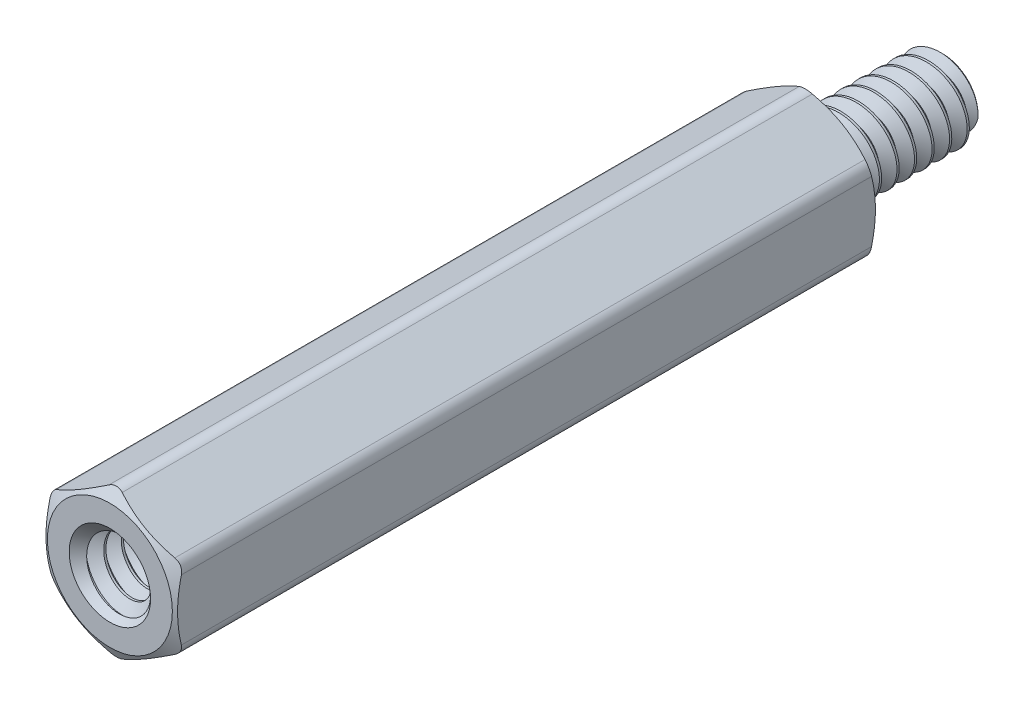
from build123d import *

# Parameters (mm, degrees)
SKETCH4_R           = 1.901825
BOSS_EXTRUDE1_DEPTH = 25.4
SKETCH5_OUTSIDE_W   = 121.674
SKETCH5_OUTSIDE_H   = 122.412
SKETCH5_OUTSIDE_R   = 2.2621875
CUT_EXTRUDE1_DEPTH  = 31.381033994
CUT_EXTRUDE1_DRAFT  = -60
SKETCH6_OUTSIDE_W   = 105.318
SKETCH6_OUTSIDE_H   = 106.056
SKETCH6_OUTSIDE_R   = 2.2621875
CUT_EXTRUDE2_DEPTH  = 26.659127427
CUT_EXTRUDE2_DRAFT  = -60
FILLET1_R           = 0.47625
CUT_SWEEP1_PITCH    = 0.635
SKETCH9_R           = 1.58115
BOSS_EXTRUDE2_DEPTH = 6.35
SKETCH10_W          = 6.35
SKETCH10_H          = 1.4224
CUT_SWEEP2_PITCH    = 0.635


with BuildPart() as part:
    # Sketch3 → Revolve1 (revolve)
    with BuildSketch(Plane(origin=(0, 0, 0), x_dir=(0, 0, -1), z_dir=(1, 0, 0))):
        with BuildLine():
            Line((-19.05, 1.26365), (-19.05, 0))
            Line((-19.05, 0), (4.7625, 0))
            Line((4.7625, 0), (4.7625, 1.26365))
            Line((4.7625, 1.26365), (4.60375, 1.4224))
            Line((4.60375, 1.4224), (0.809625, 1.4224))
            Line((0.809625, 1.4224), (0.5715, 1.009955401))
            Line((0.5715, 1.009955401), (0.15875, 1.009955401))
            ThreePointArc((0.15875, 1.009955401), (0.046496798, 1.0564522), (0, 1.168705401))
            Line((0, 1.168705401), (0, 2.38125))
            Line((0, 2.38125), (-25.4, 2.38125))
            Line((-25.4, 2.38125), (-25.4, 1.58115))
            Line((-25.4, 1.58115), (-25.24125, 1.4224))
            Line((-25.24125, 1.4224), (-19.20875, 1.4224))
            Line((-19.20875, 1.4224), (-19.05, 1.26365))
        make_face()
    revolve(axis=Axis((0, 0, -4.7625), (0, 0, 1)))

    # Sketch4 → Boss-Extrude1 (add)
    with BuildSketch(Plane.XY.offset(25.4)):
        Polygon((-2.38125, 1.374815329), (-2.38125, -1.374815329), (0, -2.749630657), (2.38125, -1.374815329), (2.38125, 1.374815329), (0, 2.749630657), align=None)
        Circle(SKETCH4_R, mode=Mode.SUBTRACT)
    extrude(amount=-BOSS_EXTRUDE1_DEPTH)


with BuildPart() as cut_extrude1_tool:
    # Sketch5 outside → Cut-Extrude1 (with draft: the straight prism first)
    with BuildSketch(Plane.XY.offset(25.4)):
        Rectangle(SKETCH5_OUTSIDE_W, SKETCH5_OUTSIDE_H)
        Circle(SKETCH5_OUTSIDE_R, mode=Mode.SUBTRACT)
    extrude(amount=-CUT_EXTRUDE1_DEPTH)
    # Cut-Extrude1: the draft: its side faces are tilted about the plane it starts from
    cut_extrude1_sides = [cut_extrude1_tool.faces().sort_by_distance(p)[0] for p in [
        (0, -61.206, 9.709483003),
        (60.837, 0, 9.709483003),
        (0, 61.206, 9.709483003),
        (-60.837, 0, 9.709483003),
        (-2.2621875, 0, 9.709483003),
    ]]
    draft(cut_extrude1_sides, Plane.XY.offset(25.4), CUT_EXTRUDE1_DRAFT)


with BuildPart() as part_1:
    add(part.part)

    # Cut-Extrude1: cut by cut_extrude1_tool
    add(cut_extrude1_tool.part, mode=Mode.SUBTRACT)


with BuildPart() as cut_extrude2_tool:
    # Sketch6 outside → Cut-Extrude2 (with draft: the straight prism first)
    with BuildSketch(Plane(origin=(0, 0, 0), x_dir=(-1, 0, 0), z_dir=(0, 0, -1))):
        Rectangle(SKETCH6_OUTSIDE_W, SKETCH6_OUTSIDE_H)
        Circle(SKETCH6_OUTSIDE_R, mode=Mode.SUBTRACT)
    extrude(amount=-CUT_EXTRUDE2_DEPTH)
    # Cut-Extrude2: the draft: its side faces are tilted about the plane it starts from
    cut_extrude2_sides = [cut_extrude2_tool.faces().sort_by_distance(p)[0] for p in [
        (0, -53.028, 13.329563713),
        (-52.659, 0, 13.329563713),
        (0, 53.028, 13.329563713),
        (52.659, 0, 13.329563713),
        (2.2621875, 0, 13.329563713),
    ]]
    draft(cut_extrude2_sides, Plane(origin=(0, 0, 0), x_dir=(-1, 0, 0), z_dir=(0, 0, -1)), CUT_EXTRUDE2_DRAFT)


with BuildPart() as part_2:
    add(part_1.part)

    # Cut-Extrude2: cut by cut_extrude2_tool
    add(cut_extrude2_tool.part, mode=Mode.SUBTRACT)

    # Fillet1
    fillet1_edges = [part_2.edges().sort_by_distance(p)[0] for p in [
        (0, 2.749630657, 12.7),
        (-2.38125, -1.374815329, 12.7),
        (0, -2.749630657, 12.7),
        (2.38125, -1.374815329, 12.7),
        (2.38125, 1.374815329, 12.7),
        (-2.38125, 1.374815329, 12.7),
    ]]
    fillet(fillet1_edges, radius=FILLET1_R)

    # Cut-Sweep1: the profile of Sketch7 profile screwed along a right-hand helix of 7.275 turns, 6 arcs to a turn; built about Z, then put on its axis
    cut_sweep1_z = Axis((0, 0, 0), (0, 0, 1))
    cut_sweep1_corners = [(1.009655401, 0, -0.238298205), (1.009655401, 0, -0.317326795), (1.456770383, 0, -0.57546875), (1.456770383, 0, 0.01984375)]
    with BuildLine(mode=Mode.PRIVATE) as cut_sweep1_profile:
        Line(cut_sweep1_corners[0], cut_sweep1_corners[1])
        Line(cut_sweep1_corners[1], cut_sweep1_corners[2])
        Line(cut_sweep1_corners[2], cut_sweep1_corners[3])
        Line(cut_sweep1_corners[3], cut_sweep1_corners[0])
    cut_sweep1_cap = Face(cut_sweep1_profile.wire())
    cut_sweep1_turn_angles = [0, 30, 60, 90, 120, 150, 180, 210, 240, 270, 300, 330, 360]
    cut_sweep1_turn_weights = [1, 0.8660254037844387, 1, 0.8660254037844387, 1, 0.8660254037844387, 1, 0.8660254037844387, 1, 0.8660254037844387, 1, 0.8660254037844387, 1]
    cut_sweep1_turn_rails = [Edge.make_bspline([Vector(p[0], p[1], 0).rotate(cut_sweep1_z, cut_sweep1_turn_angles[k]) / cut_sweep1_turn_weights[k] + Vector(0, 0, p[2] + CUT_SWEEP1_PITCH * cut_sweep1_turn_angles[k] / 360) for k in range(13)], [0, 0, 0, 1, 1, 2, 2, 3, 3, 4, 4, 5, 5, 6, 6, 6], 2, cut_sweep1_turn_weights) for p in cut_sweep1_corners]
    cut_sweep1_turn_sides = [Face.make_surface_from_curves(cut_sweep1_turn_rails[p[0]], cut_sweep1_turn_rails[p[1]]) for p in [(0, 1), (1, 2), (2, 3), (3, 0)]]
    cut_sweep1_last_angles = [2520, 2550, 2580, 2599.5, 2619]
    cut_sweep1_last_weights = [1, 0.8660254037844387, 1, 0.9426414910921771, 1]
    cut_sweep1_last_rails = [Edge.make_bspline([Vector(p[0], p[1], 0).rotate(cut_sweep1_z, cut_sweep1_last_angles[k]) / cut_sweep1_last_weights[k] + Vector(0, 0, p[2] + CUT_SWEEP1_PITCH * cut_sweep1_last_angles[k] / 360) for k in range(5)], [0, 0, 0, 1, 1, 2, 2, 2], 2, cut_sweep1_last_weights) for p in cut_sweep1_corners]
    cut_sweep1_last_sides = [Face.make_surface_from_curves(cut_sweep1_last_rails[p[0]], cut_sweep1_last_rails[p[1]]) for p in [(0, 1), (1, 2), (2, 3), (3, 0)]]
    cut_sweep1 = Plane(origin=(0, 0, -4.7625), x_dir=(0, 1, 0), z_dir=(0, 0, 1)) * Solid(Shell([*[p.moved(Location((0, 0, CUT_SWEEP1_PITCH * i))) for i in range(7) for p in cut_sweep1_turn_sides], *cut_sweep1_last_sides, cut_sweep1_cap, cut_sweep1_cap.rotate(cut_sweep1_z, 2619).moved(Location((0, 0, CUT_SWEEP1_PITCH * 2619 / 360)))]))
    add(cut_sweep1, mode=Mode.SUBTRACT)

    # Sketch9 → Boss-Extrude2 (add)
    with BuildSketch(Plane.XY.offset(19.05)):
        Circle(SKETCH9_R)
    extrude(amount=BOSS_EXTRUDE2_DEPTH)


with BuildPart() as body_2:
    # Sketch10 → Revolve2 (revolve)
    with BuildSketch(Plane(origin=(0, 0, 0), x_dir=(0, 0, -1), z_dir=(1, 0, 0))):
        with Locations((-22.225, 0.7112)):
            Rectangle(SKETCH10_W, SKETCH10_H)
    revolve(axis=Axis((0, 0, -4.7625), (0, 0, 1)))

    # Cut-Sweep2: the profile of Sketch12 profile screwed along a right-hand helix of 11 turns, 6 arcs to a turn; built about Z, then put on its axis
    cut_sweep2_z = Axis((0, 0, 0), (0, 0, 1))
    cut_sweep2_corners = [(1.009655401, 0, -0.317326795), (1.009655401, 0, -0.238298205), (1.456770383, 0, 0.01984375), (1.456770383, 0, -0.57546875)]
    with BuildLine(mode=Mode.PRIVATE) as cut_sweep2_profile:
        Line(cut_sweep2_corners[0], cut_sweep2_corners[1])
        Line(cut_sweep2_corners[1], cut_sweep2_corners[2])
        Line(cut_sweep2_corners[2], cut_sweep2_corners[3])
        Line(cut_sweep2_corners[3], cut_sweep2_corners[0])
    cut_sweep2_cap = Face(cut_sweep2_profile.wire())
    cut_sweep2_turn_angles = [0, 30, 60, 90, 120, 150, 180, 210, 240, 270, 300, 330, 360]
    cut_sweep2_turn_weights = [1, 0.8660254037844387, 1, 0.8660254037844387, 1, 0.8660254037844387, 1, 0.8660254037844387, 1, 0.8660254037844387, 1, 0.8660254037844387, 1]
    cut_sweep2_turn_rails = [Edge.make_bspline([Vector(p[0], p[1], 0).rotate(cut_sweep2_z, cut_sweep2_turn_angles[k]) / cut_sweep2_turn_weights[k] + Vector(0, 0, p[2] + CUT_SWEEP2_PITCH * cut_sweep2_turn_angles[k] / 360) for k in range(13)], [0, 0, 0, 1, 1, 2, 2, 3, 3, 4, 4, 5, 5, 6, 6, 6], 2, cut_sweep2_turn_weights) for p in cut_sweep2_corners]
    cut_sweep2_turn_sides = [Face.make_surface_from_curves(cut_sweep2_turn_rails[p[0]], cut_sweep2_turn_rails[p[1]]) for p in [(0, 1), (1, 2), (2, 3), (3, 0)]]
    cut_sweep2 = Plane(origin=(0, 0, 25.4), x_dir=(0, 1, 0), z_dir=(0, 0, -1)) * Solid(Shell([*[p.moved(Location((0, 0, CUT_SWEEP2_PITCH * i))) for i in range(11) for p in cut_sweep2_turn_sides], cut_sweep2_cap, cut_sweep2_cap.rotate(cut_sweep2_z, 3960).moved(Location((0, 0, CUT_SWEEP2_PITCH * 3960 / 360)))]))
    add(cut_sweep2, mode=Mode.SUBTRACT)


with BuildPart() as part_3:
    add(part_2.part)

    # Combine1: cut body 2
    add(body_2.part, mode=Mode.SUBTRACT)

    # Cut-Extrude3 cone 1 section (through the dimple's axis) → Cut-Extrude3 (revolve, cut)
    with BuildSketch(Plane(origin=(0, 0, 25.4), x_dir=(0, -1, 0), z_dir=(1, 0, 0))):
        Polygon((0, 0), (1.4732, 0), (0, 1.4732), align=None)
    revolve(axis=Axis((0, 0, 25.4), (0, 0, -1)), mode=Mode.SUBTRACT)


solid = part_3.part
